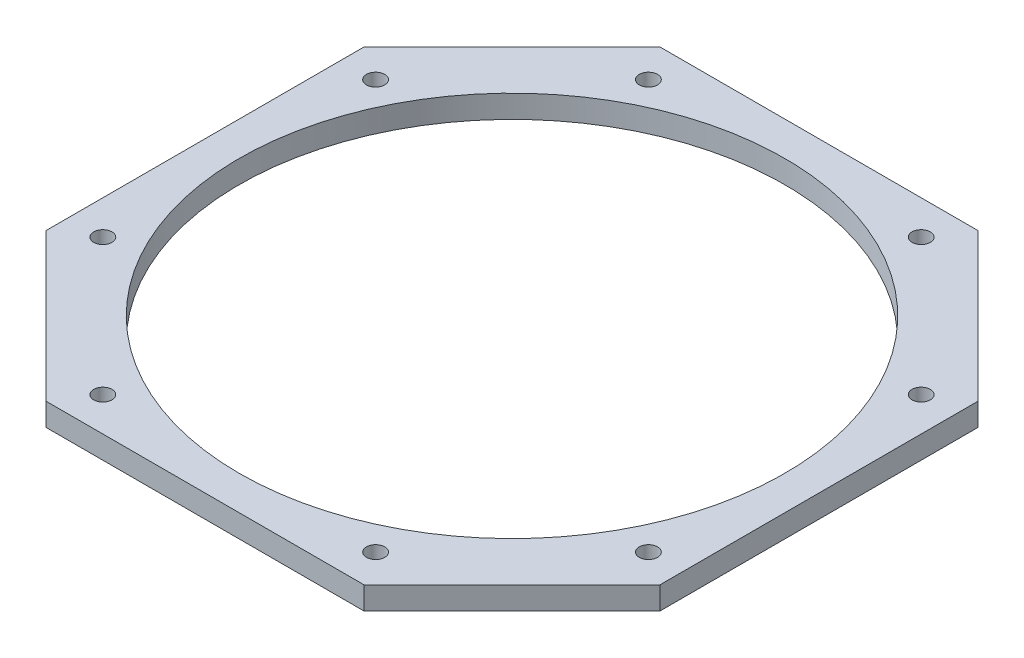
from build123d import *

# Parameters (mm, degrees)
BOSS_EXTRUDE1_DEPTH        = 6.35
F_7_0_201_DIAMETER_HOLE1_D = 5.1054
CIRPATTERN1_COUNT          = 4
SKETCH4_R                  = 76.2
CUT_EXTRUDE1_DEPTH         = 122.399644769


with BuildPart() as part:
    # Sketch1 → Boss-Extrude1 (new body)
    with BuildSketch(Plane(origin=(0, 0, 0), x_dir=(1, 0, 0), z_dir=(0, 1, 0))):
        Polygon((-85.725, 44.45), (-44.45, 85.725), (44.45, 85.725), (85.725, 44.45), (85.725, -44.45), (44.45, -85.725), (-44.45, -85.725), (-85.725, -44.45), align=None)
    extrude(amount=BOSS_EXTRUDE1_DEPTH)

    # #7 (0.201) Diameter Hole1 (through all)
    with Locations(Plane(origin=(0, 6.35, 0), x_dir=(-1, 0, 0), z_dir=(0, 1, 0))):
        with Locations((38.1, -76.2), (-38.1, -76.2)):
            f_7_0_201_diameter_hole1 = Hole(F_7_0_201_DIAMETER_HOLE1_D / 2)

    # CirPattern1: #7 (0.201) Diameter Hole1 ×4 about axis
    cirpattern1_axis = Axis((0, 0, 0), (0, 1, 0))
    for i in range(1, CIRPATTERN1_COUNT):
        add(f_7_0_201_diameter_hole1.rotate(cirpattern1_axis, i * 360 / CIRPATTERN1_COUNT), mode=Mode.SUBTRACT)

    # Sketch4 → Cut-Extrude1 (cut, through all)
    with BuildSketch(Plane(origin=(0, 6.35, 0), x_dir=(1, 0, 0), z_dir=(0, 1, 0))):
        Circle(SKETCH4_R)
    extrude(amount=-CUT_EXTRUDE1_DEPTH, mode=Mode.SUBTRACT)


solid = part.part
